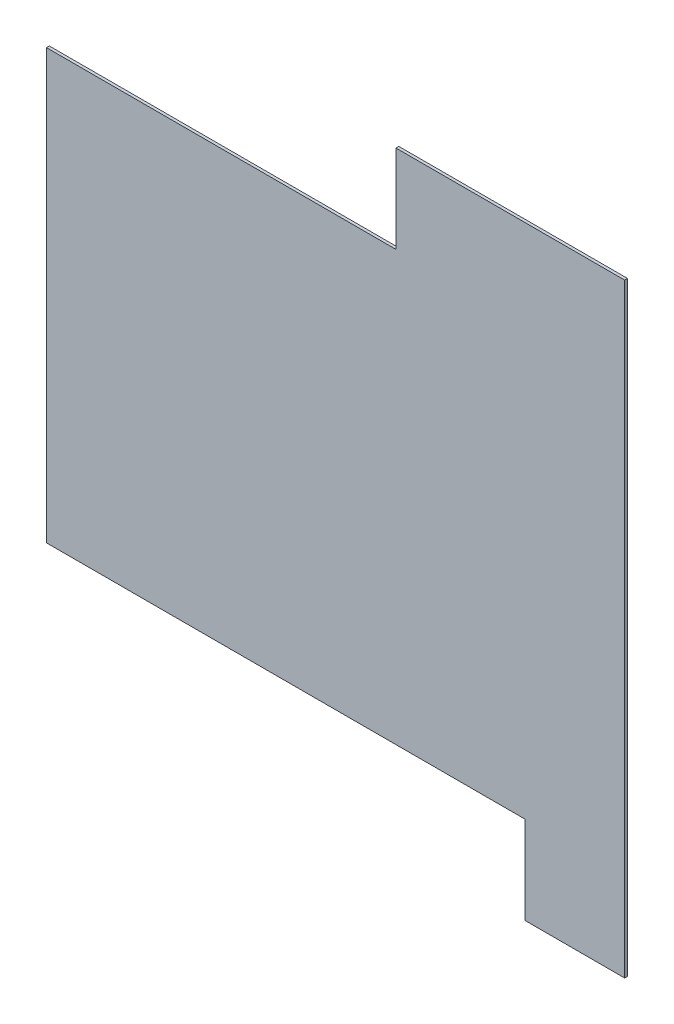
from build123d import *

# Parameters (mm, degrees)
BOSS_EXTRUDE1_DEPTH = 10


with BuildPart() as part:
    # Sketch1 → Boss-Extrude1 (new body)
    with BuildSketch(Plane.XY):
        Polygon((1230, 1510), (0, 1510), (0, 0), (1685, 0), (1685, -309), (2035, -309), (2035, 1819), (1230, 1819), align=None)
    extrude(amount=BOSS_EXTRUDE1_DEPTH)


solid = part.part
